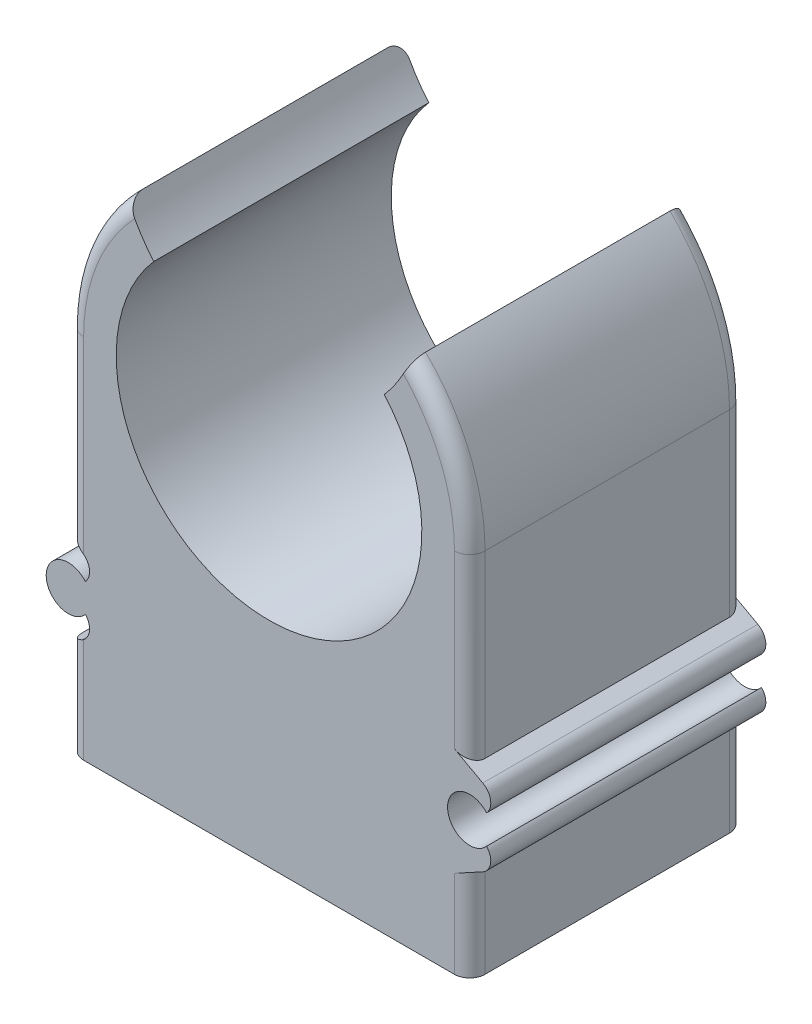
from build123d import *

# Parameters (mm, degrees)
SKETCH1_R            = 7.9375
BOSS_EXTRUDE19_DEPTH = 7.14375
SKETCH2_R            = 7.9375
CUT_EXTRUDE2_DEPTH   = 27.966981115
FILLET6_R            = 0.79375
FILLET7_R            = 0.79375


with BuildPart() as part:
    # Sketch1 → Boss-Extrude19 (new, symmetric)
    with BuildSketch(Plane.XY):
        with BuildLine():
            Line((-10.424745199, -14.070645408), (-10.424745199, -19.05))
            Line((-10.424745199, -19.05), (10.424745199, -19.05))
            Line((10.424745199, -19.05), (10.424745199, -14.070645408))
            Line((10.424745199, -14.070645408), (12.656338894, -12.854690118))
            Line((12.656338894, -12.854690118), (11.297531111, -12.4543891))
            ThreePointArc((11.297531111, -12.4543891), (9.273116661, -11.703061579), (11.297531111, -10.951734059))
            Line((11.297531111, -10.951734059), (12.656338894, -10.551433041))
            Line((12.656338894, -10.551433041), (10.424745199, -9.33547775))
            Line((10.424745199, -9.33547775), (10.424745199, 0))
            ThreePointArc((10.424745199, 0), (0, 10.424745199), (-10.424745199, 0))
            Line((-10.424745199, 0), (-10.424745199, -9.33547775))
            Line((-10.424745199, -9.33547775), (-8.193151504, -10.580610736))
            Line((-8.193151504, -10.580610736), (-9.542093319, -10.963349508))
            ThreePointArc((-9.542093319, -10.963349508), (-11.576373738, -11.703061579), (-9.542093319, -12.442773651))
            Line((-9.542093319, -12.442773651), (-8.193151504, -12.825512422))
            Line((-8.193151504, -12.825512422), (-10.424745199, -14.070645408))
        make_face()
        Circle(SKETCH1_R, mode=Mode.SUBTRACT)
    extrude(amount=BOSS_EXTRUDE19_DEPTH, both=True)

    # Sketch2 → Cut-Extrude2 (cut, through all)
    with BuildSketch(Plane.XY.offset(7.14375)):
        with Locations((0, 10.424745199)):
            Circle(SKETCH2_R)
    extrude(amount=-CUT_EXTRUDE2_DEPTH, mode=Mode.SUBTRACT)

    # Fillet6
    # the kernel refuses this fillet: 0.79375 mm, written as the material it adds along each edge
    with BuildSketch(Plane(origin=(-8.193151504, -12.825512422, -7.14375), x_dir=(-0.8732655856931067, -0.4872445144319999, 0), z_dir=(0, 0, 1))) as fillet6_piece_1:
        with BuildLine():
            CenterArc((1.76022016, -0.79375), FILLET6_R, 90, 104.42604794)
            Line((0.991497097, -0.991497097), (0.976122636, -0.995452039))
            ThreePointArc((0.976122636, -0.995452039), (0.484523228, -0.506973869), (-0.01122532, -0.01122532))
            Line((-0.01122532, -0.01122532), (0, 0.015875))
            Line((0, 0.015875), (1.76022016, 0.015875))
            Line((1.76022016, 0.015875), (1.76022016, 0))
        make_face()
    extrude(amount=14.2875)
    with BuildSketch(Plane(origin=(-8.193151504, -10.580610736, -7.14375), x_dir=(-0.962025917671251, -0.2729581171696266, 0), z_dir=(0, 0, 1))) as fillet6_piece_2:
        with BuildLine():
            CenterArc((1.805929619, -0.683397604), FILLET6_R, 120.57395206, 104.42604794)
            Line((1.244663612, -1.244663612), (1.233438292, -1.255888932))
            Line((1.233438292, -1.255888932), (-0.01122532, -0.01122532))
            Line((-0.01122532, -0.01122532), (0, 0.015875))
            ThreePointArc((0, 0.015875), (0.701094321, 0.015875), (1.394113822, 0.013667952))
            Line((1.394113822, 0.013667952), (1.402188642, 0))
        make_face()
    extrude(amount=14.2875)
    # the kernel refuses this fillet: 0.79375 mm, written as the material it takes off along each edge
    with BuildSketch(Plane(origin=(12.656338894, -12.854690118, -11.562971269), x_dir=(-0.9592408744906186, 0.28258971089987234, 0), z_dir=(0, 0, 1))) as fillet6_2_piece_1:
        with BuildLine():
            CenterArc((1.811210538, 0.688678523), FILLET6_R, 135, 105.183982463)
            Line((1.249944531, 1.249944531), (1.238719211, 1.261169851))
            Line((1.238719211, 1.261169851), (-0.01122532, 0.01122532))
            Line((-0.01122532, 0.01122532), (0, -0.015875))
            ThreePointArc((0, -0.015875), (0.708272458, -0.015875), (1.408651603, -0.01377357))
            Line((1.408651603, -0.01377357), (1.416544915, 0))
        make_face()
    extrude(amount=23.125942539, mode=Mode.SUBTRACT)
    with BuildSketch(Plane(origin=(12.656338894, -10.551433041, -11.562971269), x_dir=(-0.8781068280147701, 0.4784646262722449, 0), z_dir=(0, 0, 1))) as fillet6_2_piece_2:
        with BuildLine():
            CenterArc((1.767688508, 0.79375), FILLET6_R, 164.816017537, 105.183982463)
            Line((1.001648515, 1.001648515), (0.986327716, 1.005806486))
            ThreePointArc((0.986327716, 1.005806486), (0.489598938, 0.512049578), (-0.01122532, 0.01122532))
            Line((-0.01122532, 0.01122532), (0, -0.015875))
            Line((0, -0.015875), (1.767688508, -0.015875))
            Line((1.767688508, -0.015875), (1.767688508, 0))
        make_face()
    extrude(amount=23.125942539, mode=Mode.SUBTRACT)

    # Fillet7
    fillet7_edges = [part.edges().sort_by_distance(p)[0] for p in [
        (-10.424745199, -16.560322704, -7.14375),
        (-10.424745199, -4.667738875, -7.14375),
        (-9.622646342, 4.009986266, -7.14375),
        (9.622646342, 4.009986266, -7.14375),
        (10.424745199, -4.667738875, -7.14375),
        (10.424745199, -16.560322704, -7.14375),
        (10.424745199, -16.560322704, 7.14375),
        (-10.424745199, -16.560322704, 7.14375),
        (-10.424745199, -4.667738875, 7.14375),
        (-9.622646342, 4.009986266, 7.14375),
        (9.622646342, 4.009986266, 7.14375),
        (10.424745199, -4.667738875, 7.14375),
    ]]
    fillet(fillet7_edges, radius=FILLET7_R)


solid = part.part
